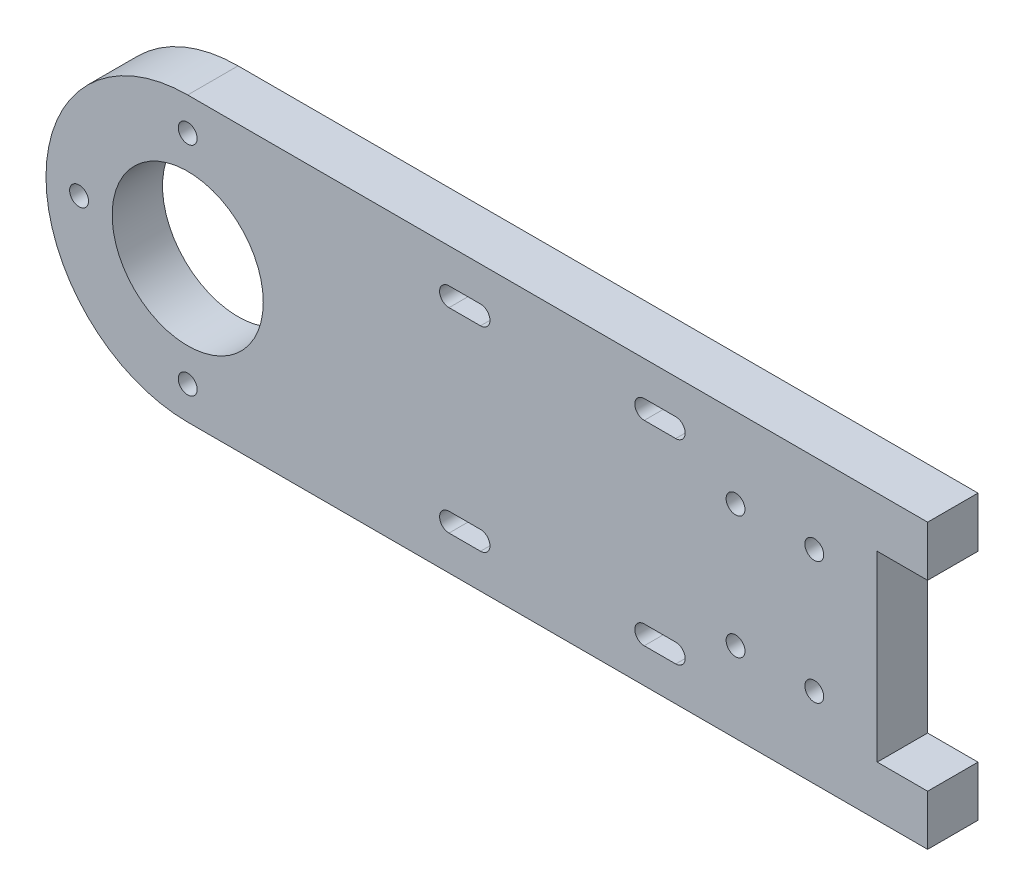
from build123d import *

# Parameters (mm, degrees)
BOSS_EXTRUDE1_DEPTH = 8
SKETCH5_R           = 12
CUT_EXTRUDE4_DEPTH  = 8
FILLET6_R           = 22.5
SKETCH6_R           = 1.5
CUT_EXTRUDE5_DEPTH  = 8
CUT_EXTRUDE6_DEPTH  = 10
SKETCH11_R          = 1.5
CUT_EXTRUDE7_DEPTH  = 8


with BuildPart() as part:
    # Sketch1 → Boss-Extrude1 (new body)
    with BuildSketch(Plane.XY):
        Polygon((-8, 37), (0, 37), (0, 45), (-140, 45), (-140, 22.5), (-140, 0), (0, 0), (0, 8), (-8, 8), align=None)
    extrude(amount=BOSS_EXTRUDE1_DEPTH)

    # Sketch5 → Cut-Extrude4 (cut)
    with BuildSketch(Plane.XY.offset(8)):
        with Locations((-117.5, 22.5)):
            Circle(SKETCH5_R)
    extrude(amount=-CUT_EXTRUDE4_DEPTH, mode=Mode.SUBTRACT)

    # Fillet6
    fillet6_edges = [part.edges().sort_by_distance(p)[0] for p in [
        (-140, 45, 4),
        (-140, 0, 4),
    ]]
    fillet(fillet6_edges, radius=FILLET6_R - 0.0001)  # a hair under: the kernel refuses the full size

    # Sketch6 → Cut-Extrude5 (cut)
    with BuildSketch(Plane.XY.offset(8)):
        with Locations((-18, 12.75)):
            Circle(SKETCH6_R)
        with Locations((-18, 32.25)):
            Circle(SKETCH6_R)
        with Locations((-30.5, 32.25)):
            Circle(SKETCH6_R)
        with Locations((-30.5, 12.75)):
            Circle(SKETCH6_R)
    extrude(amount=-CUT_EXTRUDE5_DEPTH, mode=Mode.SUBTRACT)

    # Sketch7 → Cut-Extrude6 (cut)
    with BuildSketch(Plane.XY.offset(8)):
        with BuildLine():
            Line((-76, 39.5), (-71, 39.5))
            ThreePointArc((-71, 39.5), (-69.5, 38), (-71, 36.5))
            Line((-71, 36.5), (-76, 36.5))
            ThreePointArc((-76, 36.5), (-77.5, 38), (-76, 39.5))
        make_face()
        with BuildLine():
            Line((-45, 39.5), (-40, 39.5))
            ThreePointArc((-40, 39.5), (-38.5, 38), (-40, 36.5))
            Line((-40, 36.5), (-45, 36.5))
            ThreePointArc((-45, 36.5), (-46.5, 38), (-45, 39.5))
        make_face()
        with BuildLine():
            Line((-45, 8.5), (-40, 8.5))
            ThreePointArc((-40, 8.5), (-38.5, 7), (-40, 5.5))
            Line((-40, 5.5), (-45, 5.5))
            ThreePointArc((-45, 5.5), (-46.5, 7), (-45, 8.5))
        make_face()
        with BuildLine():
            Line((-76, 8.5), (-71, 8.5))
            ThreePointArc((-71, 8.5), (-69.5, 7), (-71, 5.5))
            Line((-71, 5.5), (-76, 5.5))
            ThreePointArc((-76, 5.5), (-77.5, 7), (-76, 8.5))
        make_face()
    extrude(amount=-CUT_EXTRUDE6_DEPTH, mode=Mode.SUBTRACT)

    # Sketch11 → Cut-Extrude7 (cut)
    with BuildSketch(Plane.XY.offset(8)):
        with Locations((-134.75, 22.5)):
            Circle(SKETCH11_R)
        with Locations((-117.5, 5.25)):
            Circle(SKETCH11_R)
        with Locations((-117.5, 39.75)):
            Circle(SKETCH11_R)
    extrude(amount=-CUT_EXTRUDE7_DEPTH, mode=Mode.SUBTRACT)


solid = part.part
